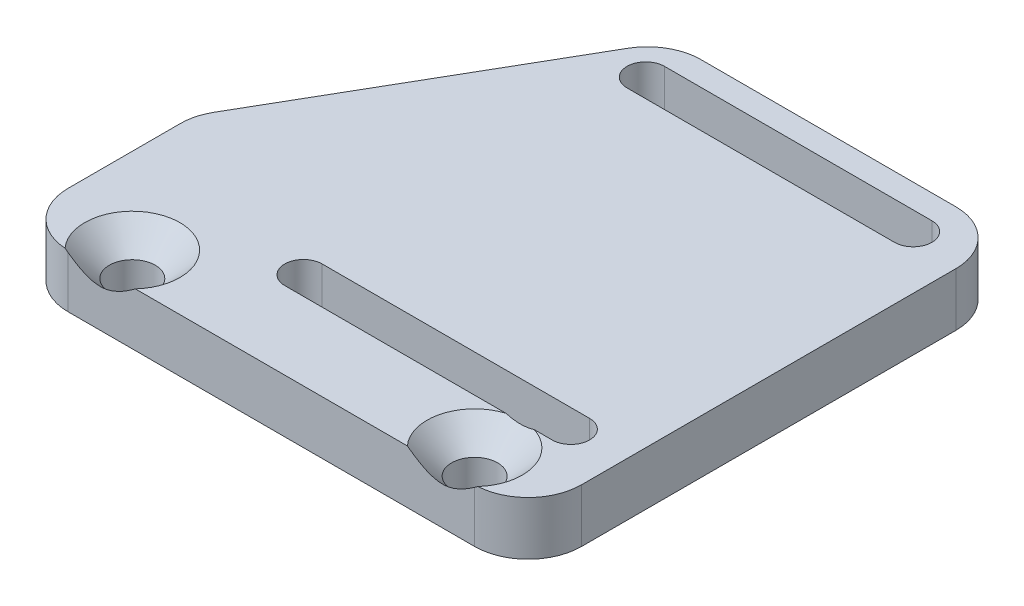
from build123d import *

# Parameters (mm, degrees)
SKETCH1_W               = 48
SKETCH1_H               = 45
SKETCH1_R               = 2.15
BOSS_EXTRUDE1_DEPTH     = 5
CUT_EXTRUDE1_DEPTH      = 66.984846745
CUT_EXTRUDE1_DEPTH_BACK = 66.984846745
FILLET1_R               = 5
CHAMFER1_SIZE           = 2.3


with BuildPart() as part:
    # Sketch1 → Boss-Extrude1 (new body)
    with BuildSketch(Plane(origin=(0, 0, 0), x_dir=(1, 0, 0), z_dir=(0, 1, 0))):
        with Locations((-24, 22.5)):
            Rectangle(SKETCH1_W, SKETCH1_H)
        with Locations(Location((-40, 3, 0), (0, 0, 270))):
            Circle(SKETCH1_R, mode=Mode.SUBTRACT)
        with Locations(Location((-8, 3, 0), (0, 0, 270))):
            Circle(SKETCH1_R, mode=Mode.SUBTRACT)
        with BuildLine():
            Line((-30, 10.75), (-5, 10.75))
            ThreePointArc((-5, 10.75), (-3.25, 9), (-5, 7.25))
            Line((-5, 7.25), (-30, 7.25))
            ThreePointArc((-30, 7.25), (-31.75, 9), (-30, 10.75))
        make_face(mode=Mode.SUBTRACT)
        with BuildLine():
            Line((-30, 42.75), (-5, 42.75))
            ThreePointArc((-5, 42.75), (-3.25, 41), (-5, 39.25))
            Line((-5, 39.25), (-30, 39.25))
            ThreePointArc((-30, 39.25), (-31.75, 41), (-30, 42.75))
        make_face(mode=Mode.SUBTRACT)
    extrude(amount=BOSS_EXTRUDE1_DEPTH)

    # Sketch2 → Cut-Extrude1 (cut, two sides: drawn at the far end of the back side and taken through both)
    with BuildSketch(Plane(origin=(0, 5, 0), x_dir=(1, 0, 0), z_dir=(0, 1, 0)).offset(-CUT_EXTRUDE1_DEPTH_BACK)):
        Polygon((-31.732050808, 45), (-48, 16.823085464), (-48, 45), align=None)
    extrude(amount=CUT_EXTRUDE1_DEPTH + CUT_EXTRUDE1_DEPTH_BACK, mode=Mode.SUBTRACT)

    # Fillet1
    fillet1_edges = [part.edges().sort_by_distance(p)[0] for p in [
        (-31.732050808, 2.5, -45),
        (-48, 2.5, -16.823085464),
        (0, 2.5, 0),
        (-48, 2.5, 0),
        (0, 2.5, -45),
    ]]
    fillet(fillet1_edges, radius=FILLET1_R)

    # Chamfer1
    # the kernel refuses this chamfer: 2.3 mm, written as the material it takes off along each edge
    with BuildSketch(Plane(origin=(-40, 5, -3), x_dir=(0, 0, 1), z_dir=(-1, 0, 0))) as chamfer1_piece_1:
        Polygon((2.15 + CHAMFER1_SIZE, 0), (2.15, -CHAMFER1_SIZE), (2.15, 0), align=None)
    revolve(axis=Axis((-40, 5, -3), (0, 1, 0)), mode=Mode.SUBTRACT)
    with BuildSketch(Plane(origin=(-8, 5, -3), x_dir=(0, 0, 1), z_dir=(-1, 0, 0))) as chamfer1_piece_2:
        Polygon((2.15 + CHAMFER1_SIZE, 0), (2.15, -CHAMFER1_SIZE), (2.15, 0), align=None)
    revolve(axis=Axis((-8, 5, -3), (0, 1, 0)), mode=Mode.SUBTRACT)


solid = part.part
